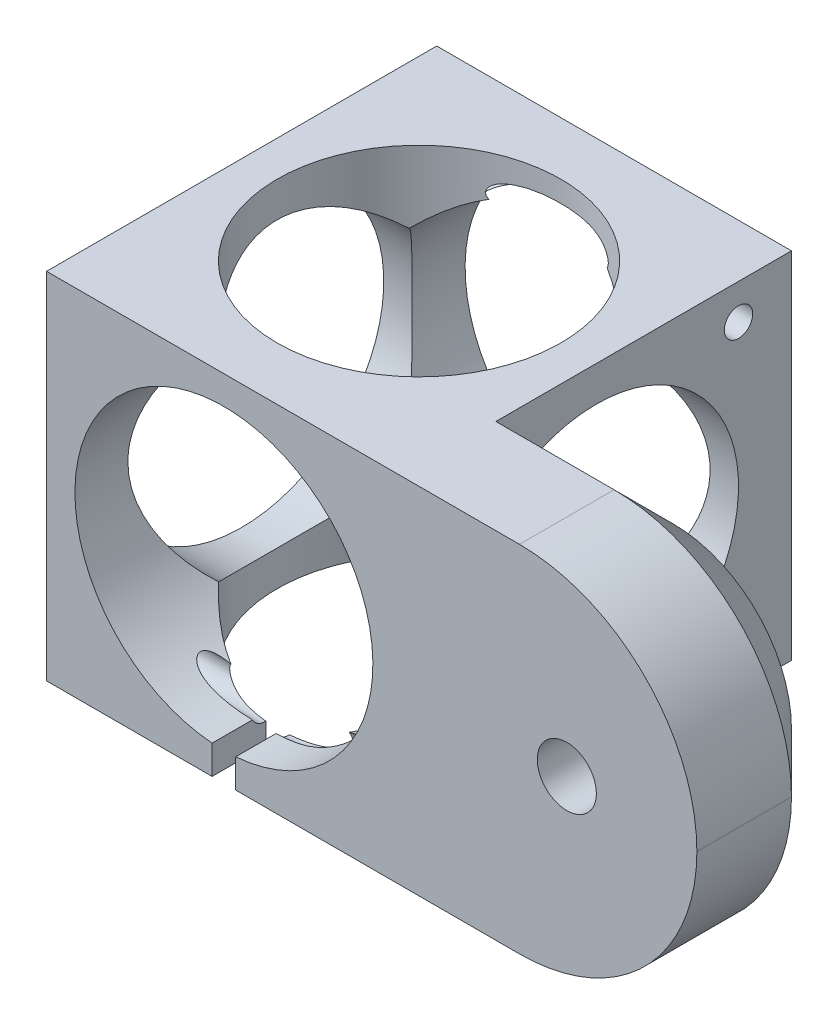
from build123d import *

# Parameters (mm, degrees)
SKIZZE1_W                            = 55
SKIZZE1_H                            = 30
SKIZZE1_R                            = 12.6
SKIZZE1_R_2                          = 2.5
AUFSATZ_LINEAR_AUSTRAGEN1_DEPTH      = 16.5
SCHNITT_LINEAR_AUSTRAGEN1_DEPTH      = 46.79574216
SCHNITT_LINEAR_AUSTRAGEN1_DEPTH_BACK = 46.79574216
SKIZZE2_W                            = 25
SKIZZE2_H                            = 20
VERRUNDUNG1_R                        = 15
FASE1_SIZE                           = 5
SKIZZE3_R                            = 1.2
SKIZZE3_R_2                          = 12.02081528
SCHNITT_LINEAR_AUSTRAGEN2_DEPTH      = 30
SCHNITT_LINEAR_AUSTRAGEN3_DEPTH      = 46.795742196
SCHNITT_LINEAR_AUSTRAGEN3_DEPTH_BACK = 46.795742196
SKIZZE4_W                            = 2
SKIZZE4_H                            = 21.632400569
FASE2_SIZE                           = 5
VERRUNDUNG2_R                        = 10
SCHNITT_LINEAR_AUSTRAGEN4_DEPTH      = 46.795742196
SCHNITT_LINEAR_AUSTRAGEN4_DEPTH_BACK = 46.795742196
SKIZZE5_R                            = 12


# Some blends are built 0.0001 mm under size
with BuildPart() as part:
    # Skizze1 → Aufsatz-Linear austragen1 (new, symmetric)
    with BuildSketch(Plane.XY):
        with Locations((12.5, 0)):
            Rectangle(SKIZZE1_W, SKIZZE1_H)
        Circle(SKIZZE1_R, mode=Mode.SUBTRACT)
        with Locations((29, 0)):
            Circle(SKIZZE1_R_2, mode=Mode.SUBTRACT)
    extrude(amount=AUFSATZ_LINEAR_AUSTRAGEN1_DEPTH, both=True)

    # Skizze2 → Schnitt-Linear austragen1 (cut, two sides: drawn at the far end of the back side and taken through both)
    with BuildSketch(Plane(origin=(0, 0, 0), x_dir=(1, 0, 0), z_dir=(0, 1, 0)).offset(-SCHNITT_LINEAR_AUSTRAGEN1_DEPTH_BACK)):
        with Locations((27.5, 6.5)):
            Rectangle(SKIZZE2_W, SKIZZE2_H)
    extrude(amount=SCHNITT_LINEAR_AUSTRAGEN1_DEPTH + SCHNITT_LINEAR_AUSTRAGEN1_DEPTH_BACK, mode=Mode.SUBTRACT)

    # Verrundung1
    verrundung1_edges = [part.edges().sort_by_distance(p)[0] for p in [
        (40, 15, 10),
        (40, -15, 10),
    ]]
    fillet(verrundung1_edges, radius=VERRUNDUNG1_R - 0.0001)  # a hair under: the kernel refuses the full size

    # Fase1
    fase1_edges = [part.edges().sort_by_distance(p)[0] for p in [
        (20.00005, -15, 3.5),
        (20.00005, 15, 3.5),
        (35.606631007, -10.606631007, 3.5),
        (35.606631007, 10.606631007, 3.5),
    ]]
    chamfer(fase1_edges, length=FASE1_SIZE)

    # Skizze3 → Schnitt-Linear austragen2 (cut)
    with BuildSketch(Plane.ZY.offset(15)):
        with Locations((-12.02081528, -12.02081528)):
            Circle(SKIZZE3_R)
        with Locations((-12.02081528, 12.02081528)):
            Circle(SKIZZE3_R)
        with Locations((12.02081528, 12.02081528)):
            Circle(SKIZZE3_R)
        with Locations((12.02081528, -12.02081528)):
            Circle(SKIZZE3_R)
        Circle(SKIZZE3_R_2)
    extrude(amount=-SCHNITT_LINEAR_AUSTRAGEN2_DEPTH, mode=Mode.SUBTRACT)

    # Skizze4 → Schnitt-Linear austragen3 (cut, two sides: drawn at the far end of the back side and taken through both)
    with BuildSketch(Plane.XY.offset(-SCHNITT_LINEAR_AUSTRAGEN3_DEPTH_BACK)):
        with Locations((0, -10.816200285)):
            Rectangle(SKIZZE4_W, SKIZZE4_H)
    extrude(amount=SCHNITT_LINEAR_AUSTRAGEN3_DEPTH + SCHNITT_LINEAR_AUSTRAGEN3_DEPTH_BACK, mode=Mode.SUBTRACT)

    # Fase2
    # the kernel refuses this chamfer: 5 mm, written as the material it takes off along each edge
    with BuildSketch(Plane(origin=(15, -22.85841494, 3.5), x_dir=(-0.027495876610586313, 0, 0.9996219169112968), z_dir=(0, 1, 0))) as fase2_piece_1:
        Polygon((FASE2_SIZE * 0.999621916911, FASE2_SIZE * 0.0274958766106), (-FASE2_SIZE * 0.0274958766106, FASE2_SIZE * 0.999621916911), (0, 0), align=None)
    extrude(amount=45.71682988, mode=Mode.SUBTRACT)

    # Verrundung2
    verrundung2_edges = [part.edges().sort_by_distance(p)[0] for p in [
        (20, 0, 3.5),
    ]]
    fillet(verrundung2_edges, radius=VERRUNDUNG2_R)

    # Skizze5 → Schnitt-Linear austragen4 (cut, two sides: drawn at the far end of the back side and taken through both)
    with BuildSketch(Plane(origin=(0, 0, 0), x_dir=(1, 0, 0), z_dir=(0, 1, 0)).offset(-SCHNITT_LINEAR_AUSTRAGEN4_DEPTH_BACK)):
        with Locations(Location((0, 0, 0), (0, 0, 270))):
            Circle(SKIZZE5_R)
    extrude(amount=SCHNITT_LINEAR_AUSTRAGEN4_DEPTH + SCHNITT_LINEAR_AUSTRAGEN4_DEPTH_BACK, mode=Mode.SUBTRACT)


solid = part.part
